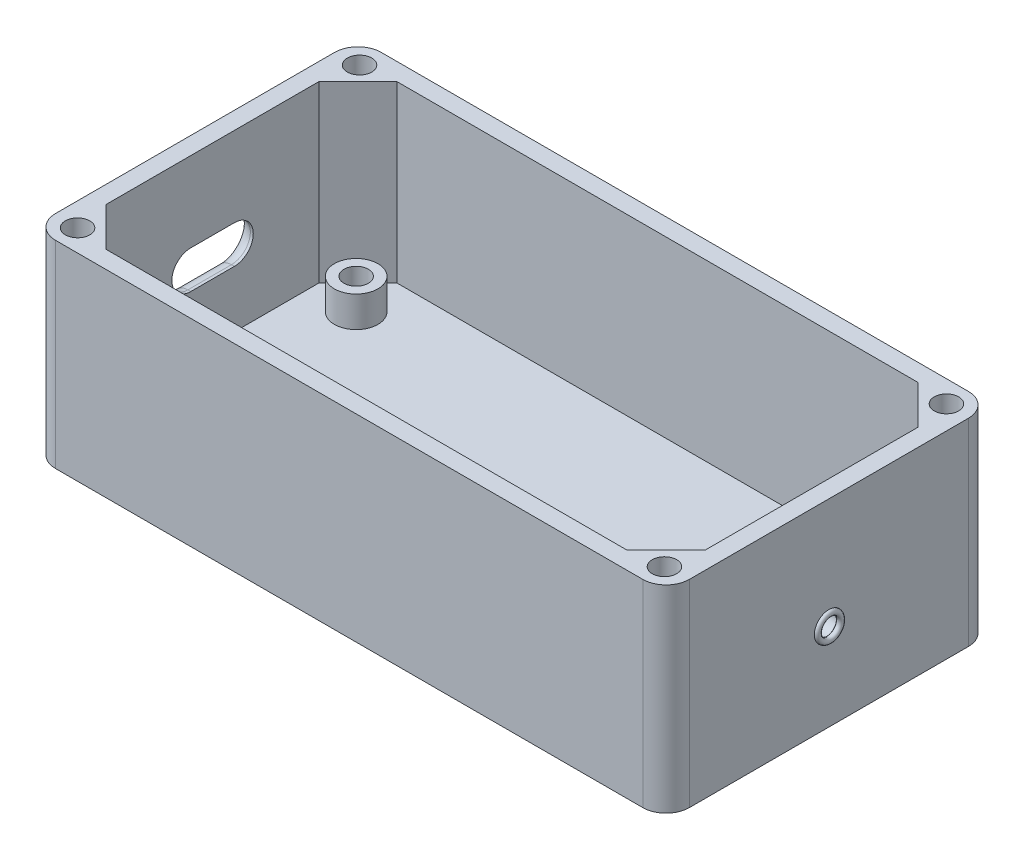
from build123d import *

# Parameters (mm, degrees)
SKETCH1_W                          = 109
SKETCH1_H                          = 56
BASE_PLATE_DEPTH                   = 34
SKETCH2_W                          = 103
SKETCH2_H                          = 50
BASE_PLATE_EXTRUDED_CUT_PART_DEPTH = 30
BASE_PLATE_4_SCREWS_DEPTH          = 30
FILLET1_R                          = 4
SKETCH4_R                          = 3.75
PCB_STANDS_DEPTH                   = 5.3
SKETCH5_R                          = 2.1
CUT_EXTRUDE1_DEPTH                 = 5.3
SKETCH8_R                          = 2
CUT_EXTRUDE4_DEPTH                 = 4
SKETCH71_R                         = 2.1
CUT_EXTRUDE5_DEPTH                 = 28
CUT_EXTRUDE7_DEPTH                 = 10
FILLET3_R                          = 2.5


# Read off the part's stored shape, not the designer's step: Sweep1
with BuildPart() as part:
    # Sketch1 → Base_Plate (new body)
    with BuildSketch(Plane(origin=(0, 0, 0), x_dir=(1, 0, 0), z_dir=(0, 1, 0))):
        with Locations((2.5, 0)):
            Rectangle(SKETCH1_W, SKETCH1_H)
    extrude(amount=BASE_PLATE_DEPTH)

    # Sketch2 → Base_Plate_Extruded_Cut_Part (cut)
    with BuildSketch(Plane(origin=(0, 34, 0), x_dir=(1, 0, 0), z_dir=(0, 1, 0))):
        with Locations((2.5, 0)):
            Rectangle(SKETCH2_W, SKETCH2_H)
    extrude(amount=-BASE_PLATE_EXTRUDED_CUT_PART_DEPTH, mode=Mode.SUBTRACT)

    # Sketch3 → Base_Plate_4_screws (add)
    with BuildSketch(Plane(origin=(0, 4, 0), x_dir=(1, 0, 0), z_dir=(0, 1, 0))):
        Polygon((-49, -25), (-42.3, -25), (-49, -18.3), align=None)
        Polygon((-49, 25), (-42.3, 25), (-49, 18.3), align=None)
        Polygon((54, 25), (54, 18.3), (47.3, 25), align=None)
        Polygon((54, -25), (54, -18.3), (47.3, -25), align=None)
    extrude(amount=BASE_PLATE_4_SCREWS_DEPTH)

    # Fillet1
    fillet1_edges = [part.edges().sort_by_distance(p)[0] for p in [
        (-52, 17, -28),
        (57, 17, -28),
        (57, 17, 28),
        (-52, 17, 28),
    ]]
    fillet(fillet1_edges, radius=FILLET1_R)

    # Sketch4 → PCB_Stands (add)
    with BuildSketch(Plane(origin=(0, 4, 0), x_dir=(1, 0, 0), z_dir=(0, 1, 0))):
        with Locations(Location((-41.5, -17.8, 0), (0, 0, 270))):
            Circle(SKETCH4_R)
        with Locations(Location((-41.5, 17.2, 0), (0, 0, 270))):
            Circle(SKETCH4_R)
        with Locations(Location((46.5, -17.8, 0), (0, 0, 270))):
            Circle(SKETCH4_R)
        with Locations(Location((46.7, 9.699272718, 0), (0, 0, 270))):
            Circle(SKETCH4_R)
    extrude(amount=PCB_STANDS_DEPTH)

    # Sketch5 → Cut-Extrude1 (cut)
    with BuildSketch(Plane(origin=(0, 9.3, 0), x_dir=(1, 0, 0), z_dir=(0, 1, 0))):
        with Locations(Location((-41.5, 17.2, 0), (0, 0, 270))):
            Circle(SKETCH5_R)
        with Locations(Location((-41.5, -17.8, 0), (0, 0, 270))):
            Circle(SKETCH5_R)
        with Locations(Location((46.5, -17.8, 0), (0, 0, 270))):
            Circle(SKETCH5_R)
        with Locations(Location((46.7, 9.699272718, 0), (0, 0, 270))):
            Circle(SKETCH5_R)
    extrude(amount=-CUT_EXTRUDE1_DEPTH, mode=Mode.SUBTRACT)

    # Sketch8 → Cut-Extrude4 (cut)
    with BuildSketch(Plane(origin=(57, 0, 0), x_dir=(0, 0, -1), z_dir=(1, 0, 0))):
        with Locations((0, 15)):
            Circle(SKETCH8_R)
    extrude(amount=-CUT_EXTRUDE4_DEPTH, mode=Mode.SUBTRACT)

    # Sweep1 outline → Sweep1 (revolve)
    with BuildSketch(Plane(origin=(0, 15, 0), x_dir=(0, 1, 0), z_dir=(0, 0, -1))):
        with BuildLine():
            Line((2, 57), (2.5, 57))
            ThreePointArc((2.5, 57), (1.646446609, 57.353553391), (2, 56.5))
            Line((2, 56.5), (2, 57))
        make_face()
    revolve(axis=Axis((0, 15, 0), (1, 0, 0)))

    # Sketch71 → Cut-Extrude5 (cut)
    with BuildSketch(Plane(origin=(0, 34, 0), x_dir=(1, 0, 0), z_dir=(0, 1, 0))):
        with Locations(Location((-47.969368965, -24.25, 0), (0, 0, 270))):
            Circle(SKETCH71_R)
        with Locations(Location((52.969368965, -24.25, 0), (0, 0, 270))):
            Circle(SKETCH71_R)
        with Locations(Location((52.969368965, 24.25, 0), (0, 0, 270))):
            Circle(SKETCH71_R)
        with Locations(Location((-47.969368965, 24.25, 0), (0, 0, 270))):
            Circle(SKETCH71_R)
    extrude(amount=-CUT_EXTRUDE5_DEPTH, mode=Mode.SUBTRACT)

    # Sketch82 → Cut-Extrude7 (cut)
    with BuildSketch(Plane.ZY.offset(52)):
        with BuildLine():
            Line((-3.75, 20.25), (3.75, 20.25))
            ThreePointArc((3.75, 20.25), (7, 17), (3.75, 13.75))
            Line((3.75, 13.75), (-3.75, 13.75))
            ThreePointArc((-3.75, 13.75), (-7, 17), (-3.75, 20.25))
        make_face()
    extrude(amount=-CUT_EXTRUDE7_DEPTH, mode=Mode.SUBTRACT)

    # Fillet3
    fillet3_edges = [part.edges().sort_by_distance(p)[0] for p in [
        (-52, 17, -7),
        (-52, 13.75, 0),
        (-52, 17, 7),
        (-52, 20.25, 0),
    ]]
    fillet(fillet3_edges, radius=FILLET3_R)


solid = part.part
